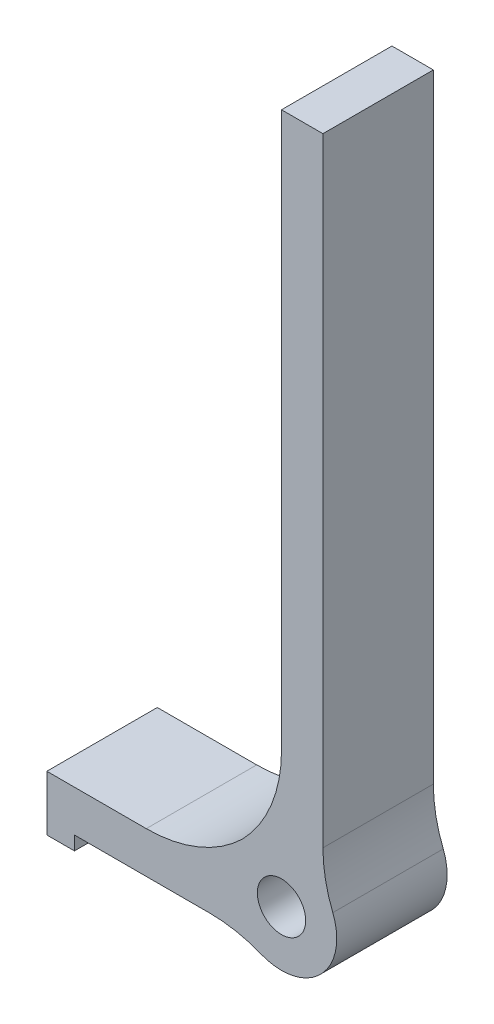
from build123d import *

# Parameters (mm, degrees)
SKETCH1_R           = 1.75
BOSS_EXTRUDE1_DEPTH = 8
FILLET1_R           = 10


with BuildPart() as part:
    # Sketch1 → Boss-Extrude1 (new body)
    with BuildSketch(Plane.XY):
        with BuildLine():
            Line((0, 0), (-2, 0))
            Line((-2, 0), (-2, 4))
            Line((-2, 4), (11, 4))
            ThreePointArc((11, 4), (12.171572875, 6.828427125), (15, 8))
            Line((15, 8), (15, 54))
            Line((15, 54), (18, 54))
            Line((18, 54), (18, 6.645751311))
            ThreePointArc((18, 6.645751311), (17.828427125, 1.171572875), (12.354248689, 1))
            Line((12.354248689, 1), (0, 1))
            Line((0, 1), (0, 0))
        make_face()
        with Locations((15, 4)):
            Circle(SKETCH1_R, mode=Mode.SUBTRACT)
    extrude(amount=BOSS_EXTRUDE1_DEPTH)

    # Fillet1
    # the kernel refuses this fillet: 10 mm, written as the material it adds along each edge
    with BuildSketch(Plane(origin=(11, 4, 0), x_dir=(-1, 0, 0), z_dir=(0, 0, 1))) as fillet1_piece_1:
        with BuildLine():
            CenterArc((5.797958971, -10), FILLET1_R, 90, 44.415308597)
            ThreePointArc((-1.200583151, -2.857142857), (-0.31234035, -1.549569715), (0, 0))
            Line((0, 0), (5.797958971, 0))
        make_face()
    extrude(amount=8)
    with BuildSketch(Plane(origin=(15, 8, 0), x_dir=(-0.9219149126204016, -0.3873924287955524, 0), z_dir=(0, 0, 1))) as fillet1_piece_2:
        with BuildLine():
            CenterArc((6.973063718, -9.219149126), FILLET1_R, 112.792345701, 44.415308597)
            Line((-2.246085408, -5.345224838), (0, 0))
            ThreePointArc((0, 0), (1.549569715, -0.31234035), (3.09913943, 0))
        make_face()
    extrude(amount=8)
    with BuildSketch(Plane(origin=(18, 6.645751311, 0), x_dir=(0, 1, 0), z_dir=(0, 0, 1))) as fillet1_piece_3:
        with BuildLine():
            CenterArc((2.550401112, -10), FILLET1_R, 90, 21.786789298)
            ThreePointArc((-1.161136333, -0.714285714), (-0.54991438, -0.406973372), (0, 0))
            Line((0, 0), (2.550401112, 0))
        make_face()
    extrude(amount=8)
    with BuildSketch(Plane(origin=(12.354248689, 1, 0), x_dir=(-1, 0, 0), z_dir=(0, 0, 1))) as fillet1_piece_4:
        with BuildLine():
            CenterArc((2.550401112, 10), FILLET1_R, 248.213210702, 21.786789298)
            ThreePointArc((-1.161136333, 0.714285714), (-0.54991438, 0.406973372), (0, 0))
            Line((0, 0), (2.550401112, 0))
        make_face()
    extrude(amount=8)


solid = part.part
